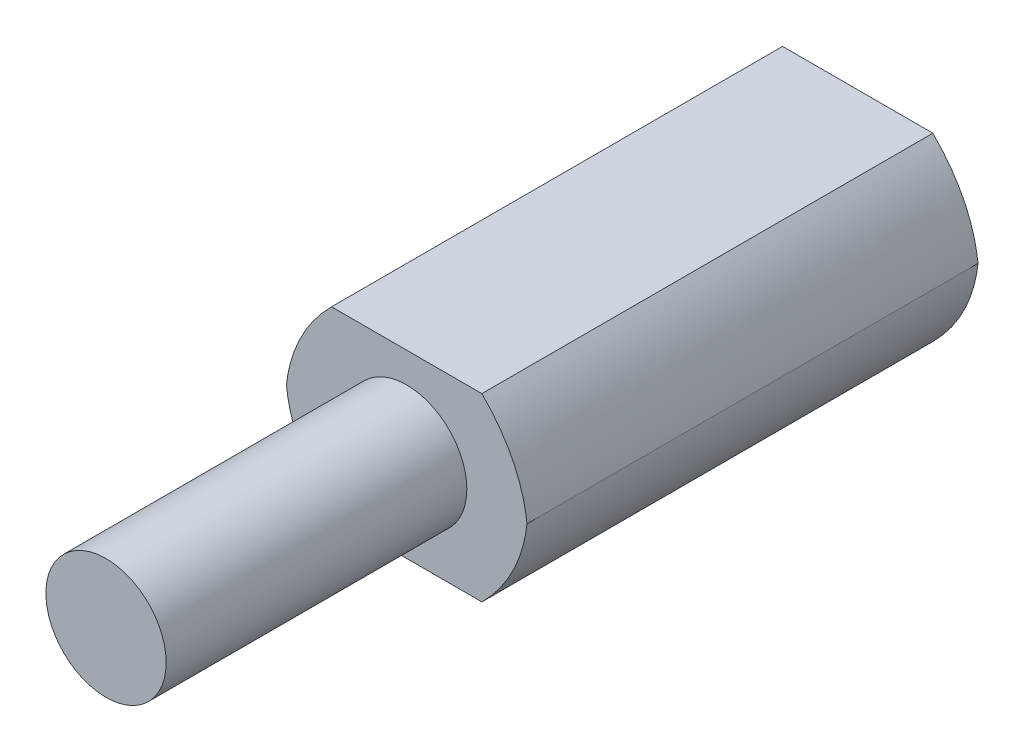
from build123d import *
from build123d.topology import SkipClean

# Parameters (mm, degrees)
SKETCH1_W               = 8
SKETCH1_H               = 6
BOSS_EXTRUDE1_DEPTH     = 15
SKETCH2_R               = 2
BOSS_EXTRUDE2_DEPTH     = 10
CUT_EXTRUDE1_DEPTH      = 27.925824036
CIRPATTERN1_DEPTH       = 15
CUT_EXTRUDE2_DEPTH      = 27.925824088
CUT_EXTRUDE2_DEPTH_BACK = 27.925824088
SKETCH4_W               = 8
SKETCH4_H               = 3


# Read off the part's stored shape, not the designer's step: CirPattern1
with BuildPart() as part:
    # Sketch1 → Boss-Extrude1 (new body)
    with BuildSketch(Plane.XY):
        with Locations((4, 3)):
            Rectangle(SKETCH1_W, SKETCH1_H)
    extrude(amount=BOSS_EXTRUDE1_DEPTH)

    # Sketch2 → Boss-Extrude2 (add)
    with BuildSketch(Plane.XY.offset(15)):
        with Locations((4, 3)):
            Circle(SKETCH2_R)
    extrude(amount=BOSS_EXTRUDE2_DEPTH)

    # Sketch3 → Cut-Extrude1 (cut, through all)
    with BuildSketch(Plane(origin=(0, 0, 0), x_dir=(-1, 0, 0), z_dir=(0, 0, -1))):
        with BuildLine():
            Line((-8, 0), (-6.5, 0))
            add(Edge.make_bspline(
                [(-6.5, 0), (-7.519049776, 1.013941068), (-7.906316023, 2.115854023), (-8, 3)],
                knots=[0, 0, 0, 0, 1, 1, 1, 1], degree=3))
            Line((-8, 3), (-8, 0))
        make_face()
    extrude(amount=-CUT_EXTRUDE1_DEPTH, mode=Mode.SUBTRACT)

    # CirPattern1 outline → CirPattern1 (cut)
    with BuildSketch(Plane.XY):
        with BuildLine():
            Line((0, 0), (1.5, 0))
            add(Edge.make_bspline(
                [(1.5, 0), (0.480950224, 1.013941068), (0.093683977, 2.115854023), (0, 3)],
                knots=[0, 0, 0, 0, 1, 1, 1, 1], degree=3))
            Line((0, 3), (0, 0))
        make_face()
    extrude(amount=CIRPATTERN1_DEPTH, mode=Mode.SUBTRACT)

    # Sketch4 → Cut-Extrude2 (cut, two sides: drawn at the far end of the back side and taken through both)
    with BuildSketch(Plane(origin=(0, 0, 0), x_dir=(-1, 0, 0), z_dir=(0, 0, -1)).offset(-CUT_EXTRUDE2_DEPTH_BACK)):
        with Locations((-4, 4.5)):
            Rectangle(SKETCH4_W, SKETCH4_H)
    extrude(amount=CUT_EXTRUDE2_DEPTH + CUT_EXTRUDE2_DEPTH_BACK, mode=Mode.SUBTRACT)

    # Mirror1: part across plane


with BuildPart() as part_1:
    with SkipClean():  # the faces are left unmerged after this step: merging them gives an invalid solid
        add(part.part)
        add(part.part.mirror(Plane(origin=(8, 3, 25), x_dir=(0, 0, 1), z_dir=(0, -1, 0))))


solid = part_1.part
